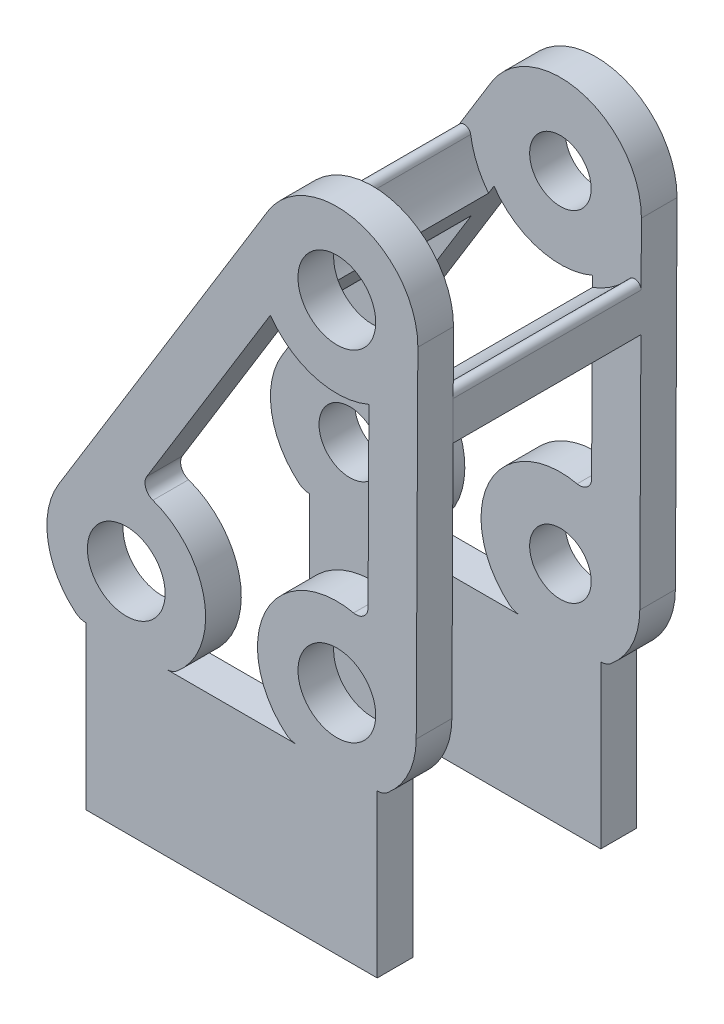
from build123d import *

# Parameters (mm, degrees)
HOUSING_R           = 0.9499999999999998
HOUSING_R_2         = 0.9500000000000001
HOUSING_R_3         = 0.95
BOSS_EXTRUDE1_DEPTH = 8
CUT_EXTRUDE1_DEPTH  = 2.9
BOSS_EXTRUDE2_DEPTH = 5.8
FILLET1_R           = 0.2
SKETCH4_R           = 1.1999999999999995
SKETCH4_R_2         = 1.2
CUT_EXTRUDE2_DEPTH  = 1.1
SKETCH5_W           = 8.991987158875418
SKETCH5_H           = 1.1000000000000005
SKETCH5_H_2         = 1.1000000000000003
BOSS_EXTRUDE3_DEPTH = 5


# Read off the part's stored shape, not the designer's step: Split1
with BuildPart() as part:
    # housing → Boss-Extrude1 (new body)
    with BuildSketch(Plane.XY):
        with BuildLine():
            ThreePointArc((7.017292273195786, 2.3947669414980512), (7.325518035981619, 2.4675712154204676), (7.463119607499124, 2.752824419893601))
            Line((7.463119607499124, 2.752824419893601), (7.489077767555448, 8.203976226227727))
            ThreePointArc((7.489077767555448, 8.203976226227727), (5.815094951659767, 8.095648720598838), (4.449478668914345, 9.069838375999874))
            Line((4.449478668914345, 9.069838375999874), (0.6320850471381863, 2.847123137185346))
            ThreePointArc((0.6320850471381863, 2.847123137185346), (0.5987139537613061, 2.5321787718236037), (0.8223068369271714, 2.3078802971434254))
            ThreePointArc((0.8223068369271714, 2.3078802971434254), (2.412392058852269, 0.42762665303569264), (1.5654791126268672, -1.8846153846153846))
            ThreePointArc((1.5654791126268672, -1.8846153846153846), (1.415835134559399, -1.9702699715629801), (1.2459935794377088, -2))
            Line((1.2459935794377088, -2), (-1.2459935794377088, -2))
            ThreePointArc((-1.2459935794377088, -2), (-1.4158351345593991, -1.9702699715629806), (-1.5654791126268672, -1.8846153846153846))
            ThreePointArc((-1.5654791126268672, -1.8846153846153846), (-2.4172505006690987, -0.3992493168622683), (-2.0883538457938933, 1.2811238093009794))
            Line((-2.0883538457938933, 1.2811238093009794), (4.369026687965414, 11.80726919316428))
            ThreePointArc((4.369026687965414, 11.80726919316428), (7.184905048340233, 12.90435127940119), (8.999971655168114, 10.488095238095253))
            Line((8.999971655168114, 10.488095238095253), (8.94997222206475, -0.01166666666666699))
            ThreePointArc((8.94997222206475, -0.01166666666666699), (8.715388584500609, -1.046209070723625), (8.065479112626866, -1.8846153846153848))
            ThreePointArc((8.065479112626866, -1.8846153846153848), (7.915835134559398, -1.9702699715629803), (7.745993579437708, -2))
            Line((7.745993579437708, -2), (5.254006420562291, -2))
            ThreePointArc((5.254006420562291, -2), (5.084164865440601, -1.9702699715629801), (4.934520887373134, -1.8846153846153848))
            ThreePointArc((4.934520887373134, -1.8846153846153848), (4.297058288140121, 1.0721696760064878), (7.017292273195786, 2.3947669414980512))
        make_face()
        with Locations((6.5, 10.500000000000014)):
            Circle(HOUSING_R, mode=Mode.SUBTRACT)
        with Locations((6.5, 1.73e-15)):
            Circle(HOUSING_R_2, mode=Mode.SUBTRACT)
        Circle(HOUSING_R_3, mode=Mode.SUBTRACT)
    extrude(amount=BOSS_EXTRUDE1_DEPTH)

    # Sketch2 → Cut-Extrude1 (cut, symmetric)
    with BuildSketch(Plane.XY.offset(4)):
        Polygon((9.299999999999999, 13.000000000000002), (-2.700000000000002, 13), (-2.700000000000001, -3.0000000000000004), (9.3, -2.999999999999999), align=None)
    extrude(amount=CUT_EXTRUDE1_DEPTH, both=True, mode=Mode.SUBTRACT)


with BuildPart() as cut_extrude1_piece_1:
    # of the separate pieces the step leaves, piece 1, a body of its own (cut_extrude1_pieces)
    add(part.part.solids().sort_by_distance((7.017292273, 2.394766941, 0))[0])



with BuildPart() as cut_extrude1_piece_2:
    # of the separate pieces the step leaves, piece 2, a body of its own (cut_extrude1_pieces)
    add(part.part.solids().sort_by_distance((7.463119607, 2.75282442, 6.9))[0])


with BuildPart() as cut_extrude1_piece_1_1:
    add(cut_extrude1_piece_1.part)

    add(cut_extrude1_piece_2.part)  # Boss-Extrude2 merges Cut-Extrude1 piece 2
    # Sketch3 → Boss-Extrude2 (add)
    with BuildSketch(Plane.XY.offset(1.1000000000000003)):
        with BuildLine():
            Line((8.985102612314783, 7.365631641579735), (8.993967121733391, 9.227157513392633))
            ThreePointArc((8.993967121733391, 9.227157513392633), (8.366539647651873, 8.41288961869681), (7.4875346650857, 7.879928381655572))
            Line((7.4875346650857, 7.879928381655572), (7.481545884228164, 6.622298660655433))
            ThreePointArc((7.481545884228164, 6.622298660655433), (8.272723590912673, 6.914271193993949), (8.985102612314783, 7.365631641579735))
        make_face()
        with BuildLine():
            Line((3.6223979495320817, 7.721618017776758), (4.280029641984488, 8.7936203208159))
            ThreePointArc((4.280029641984488, 8.7936203208159), (3.8138220786436623, 9.709779666917052), (3.7096651953681965, 10.732447151112684))
            Line((3.7096651953681965, 10.732447151112684), (2.7362479890296694, 9.145684379505001))
            ThreePointArc((2.7362479890296694, 9.145684379505001), (3.1038422897343154, 8.38668203835701), (3.6223979495320817, 7.721618017776758))
        make_face()
    extrude(amount=BOSS_EXTRUDE2_DEPTH)

    # Fillet1
    fillet1_edges = [cut_extrude1_piece_1_1.edges().sort_by_distance(p)[0] for p in [
        (8.993967121733391, 9.227157513392633, 4),
        (3.6223979495320817, 7.721618017776759, 4),
        (3.7096651953681965, 10.732447151112684, 4),
    ]]
    fillet(fillet1_edges, radius=FILLET1_R)

    # Sketch4 → Cut-Extrude2 (cut)
    with BuildSketch(Plane.XY.offset(8)):
        with Locations((6.5, 10.500000000000014)):
            Circle(SKETCH4_R)
        Circle(SKETCH4_R_2)
        with Locations((6.5, 1.73e-15)):
            Circle(SKETCH4_R)
    extrude(amount=-CUT_EXTRUDE2_DEPTH, mode=Mode.SUBTRACT)

    # Sketch5 → Boss-Extrude3 (add)
    with BuildSketch(Plane.XZ.offset(2)):
        with Locations((3.2499999999999996, 7.449999999999999)):
            Rectangle(SKETCH5_W, SKETCH5_H)
        with Locations((3.2499999999999996, 0.5500000000000002)):
            Rectangle(SKETCH5_W, SKETCH5_H_2)
    extrude(amount=BOSS_EXTRUDE3_DEPTH)


with BuildPart() as body_2:
    # Split1: the piece on the far side of the plane
    add(cut_extrude1_piece_1_1.part)
    split(bisect_by=Plane.XY.offset(6.9), keep=Keep.BOTTOM)


with BuildPart() as cut_extrude1_piece_1_2:
    add(cut_extrude1_piece_1_1.part)

    # Split1
    split(bisect_by=Plane.XY.offset(6.9), keep=Keep.TOP)


solid = Compound([body_2.part, cut_extrude1_piece_1_2.part])
